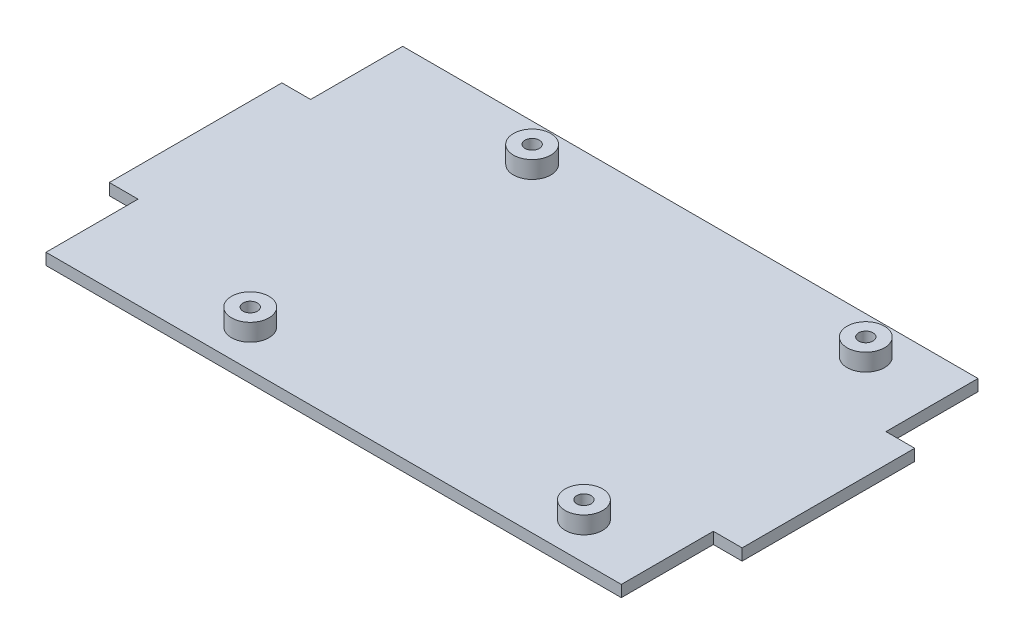
from build123d import *

# Parameters (mm, degrees)
SKETCH_1_W            = 100
SKETCH_1_H            = 62
SKETCH_1_W_2          = 110
SKETCH_1_H_2          = 30
EXTRUDE_471_DEPTH     = 2
SKETCH_2_R            = 1.25
CUT_EXTRUDE_876_DEPTH = 2
EXTRUDE_START         = 3
SKETCH_3_R            = 3.25
SKETCH_3_R_2          = 1.25
EXTRUDE_1192_DEPTH    = 3


with BuildPart() as part:
    # 草图1 → Extrude 471 (new body)
    with BuildSketch(Plane(origin=(0, 0, 0), x_dir=(1, 0, 0), z_dir=(0, 1, 0))):
        Rectangle(SKETCH_1_W, SKETCH_1_H)
        Rectangle(SKETCH_1_W_2, SKETCH_1_H_2)
    extrude(amount=EXTRUDE_471_DEPTH)

    # 草图2 → Cut-Extrude 876 (cut)
    with BuildSketch(Plane(origin=(0, 2, 0), x_dir=(1, 0, 0), z_dir=(0, 1, 0))):
        with Locations((-21, 24.5)):
            Circle(SKETCH_2_R)
        with Locations((37, 24.5)):
            Circle(SKETCH_2_R)
        with Locations((-21, -24.5)):
            Circle(SKETCH_2_R)
        with Locations((37, -24.5)):
            Circle(SKETCH_2_R)
    extrude(amount=-CUT_EXTRUDE_876_DEPTH, mode=Mode.SUBTRACT)

    # 草图3 → Extrude 1192 (add)
    # profile 1 of 4: a face of its own
    with BuildSketch(Plane(origin=(0, 2, 0), x_dir=(1, 0, 0), z_dir=(0, 1, 0)).offset(EXTRUDE_START)):
        with Locations((-21, 24.5)):
            Circle(SKETCH_3_R)
        with Locations((-21, 24.5)):
            Circle(SKETCH_3_R_2, mode=Mode.SUBTRACT)
    # profile 2 of 4: a face of its own
    with BuildSketch(Plane(origin=(0, 2, 0), x_dir=(1, 0, 0), z_dir=(0, 1, 0)).offset(EXTRUDE_START)):
        with Locations((37, 24.5)):
            Circle(SKETCH_3_R)
        with Locations((37, 24.5)):
            Circle(SKETCH_3_R_2, mode=Mode.SUBTRACT)
    # profile 3 of 4: a face of its own
    with BuildSketch(Plane(origin=(0, 2, 0), x_dir=(1, 0, 0), z_dir=(0, 1, 0)).offset(EXTRUDE_START)):
        with Locations((-21, -24.5)):
            Circle(SKETCH_3_R)
        with Locations((-21, -24.5)):
            Circle(SKETCH_3_R_2, mode=Mode.SUBTRACT)
    # profile 4 of 4: a face of its own
    with BuildSketch(Plane(origin=(0, 2, 0), x_dir=(1, 0, 0), z_dir=(0, 1, 0)).offset(EXTRUDE_START)):
        with Locations((37, -24.5)):
            Circle(SKETCH_3_R)
        with Locations((37, -24.5)):
            Circle(SKETCH_3_R_2, mode=Mode.SUBTRACT)
    extrude(amount=-EXTRUDE_1192_DEPTH)


solid = part.part
